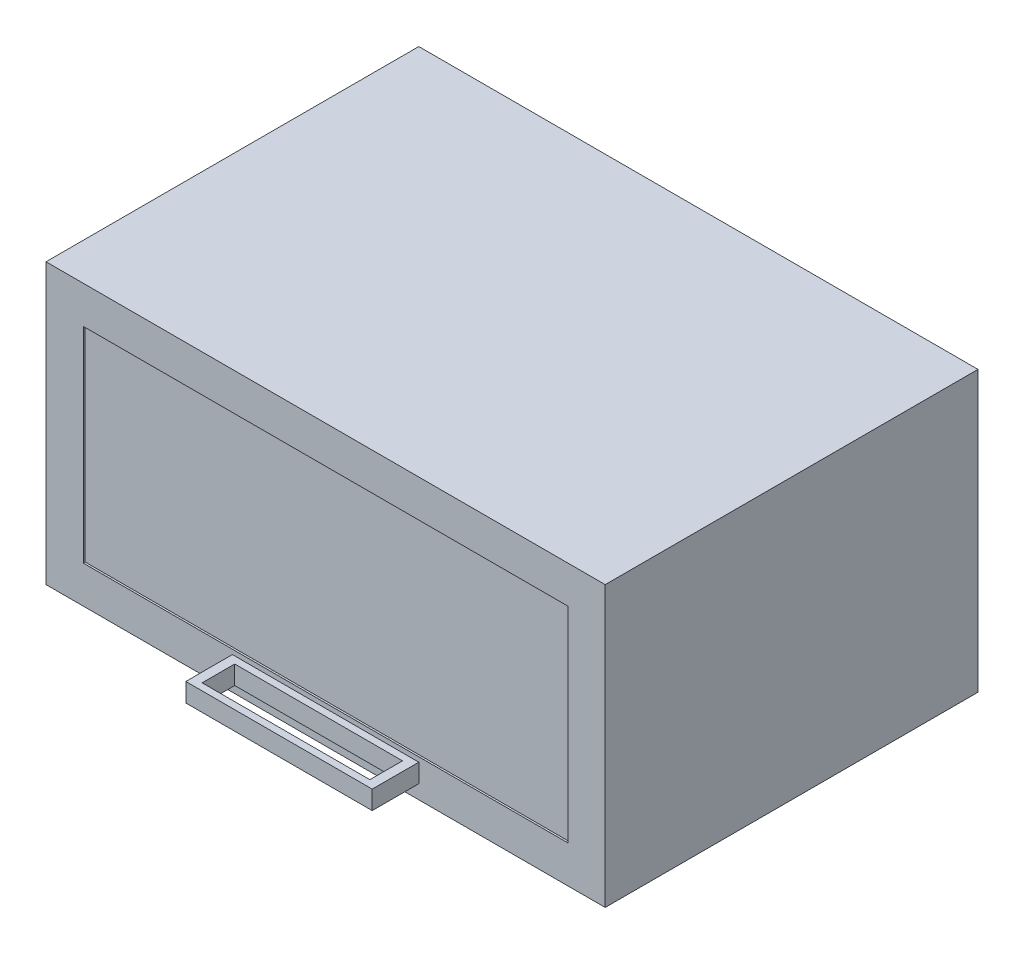
from build123d import *

# Parameters (mm, degrees)
SKETCH_1_W          = 600
SKETCH_1_H          = 400
EXTRUDE_1_DEPTH     = 300
SKETCH_2_W          = 200
SKETCH_2_H          = 20
EXTRUDE_2_DEPTH     = 50
SKETCH_3_W          = 180
SKETCH_3_H          = 35
CUT_EXTRUDE_1_DEPTH = 50
SKETCH_4_W          = 520
SKETCH_4_H          = 220
CUT_EXTRUDE_2_DEPTH = 2


with BuildPart() as part:
    # Эскиз1 → Бобышка-Вытянуть1 (new body)
    with BuildSketch(Plane(origin=(0, 0, 0), x_dir=(1, 0, 0), z_dir=(0, 1, 0))):
        with Locations((-300, -200)):
            Rectangle(SKETCH_1_W, SKETCH_1_H)
    extrude(amount=EXTRUDE_1_DEPTH)

    # Эскиз2 → Бобышка-Вытянуть2 (add)
    with BuildSketch(Plane.XY.offset(400)):
        with Locations((-300, 25)):
            Rectangle(SKETCH_2_W, SKETCH_2_H)
    extrude(amount=EXTRUDE_2_DEPTH)

    # Эскиз3 → Вырез-Вытянуть1 (cut)
    with BuildSketch(Plane(origin=(0, 35, 0), x_dir=(1, 0, 0), z_dir=(0, 1, 0))):
        with Locations((-300, -425)):
            Rectangle(SKETCH_3_W, SKETCH_3_H)
    extrude(amount=-CUT_EXTRUDE_1_DEPTH, mode=Mode.SUBTRACT)

    # Эскиз4 → Вырез-Вытянуть2 (cut)
    with BuildSketch(Plane.XY.offset(400)):
        with Locations((-300, 150)):
            Rectangle(SKETCH_4_W, SKETCH_4_H)
    extrude(amount=-CUT_EXTRUDE_2_DEPTH, mode=Mode.SUBTRACT)


solid = part.part
